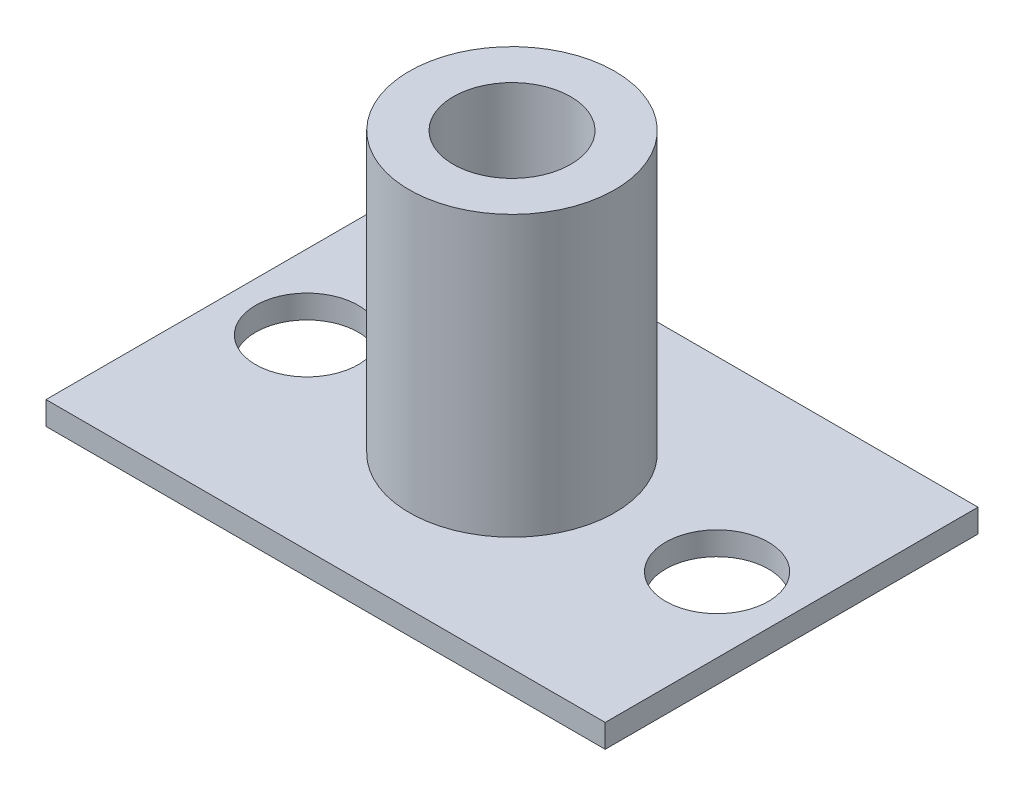
from build123d import *

# Parameters (mm, degrees)
SKETCH1_W           = 38.1
SKETCH1_H           = 25.4
BOSS_EXTRUDE1_DEPTH = 1.5875
SKETCH3_R           = 7
SKETCH3_R_2         = 4
BOSS_EXTRUDE2_DEPTH = 19.05
SKETCH4_R           = 3.5
CUT_EXTRUDE1_DEPTH  = 35.525178946


with BuildPart() as part:
    # Sketch1 → Boss-Extrude1 (new body)
    with BuildSketch(Plane(origin=(0, 0, 0), x_dir=(1, 0, 0), z_dir=(0, 1, 0))):
        with Locations((-6.79173913, 0)):
            Rectangle(SKETCH1_W, SKETCH1_H)
    extrude(amount=BOSS_EXTRUDE1_DEPTH)

    # Sketch3 → Boss-Extrude2 (add)
    with BuildSketch(Plane(origin=(0, 1.5875, 0), x_dir=(1, 0, 0), z_dir=(0, 1, 0))):
        with Locations((-6.79173913, 0)):
            Circle(SKETCH3_R)
        with Locations((-6.79173913, 0)):
            Circle(SKETCH3_R_2, mode=Mode.SUBTRACT)
    extrude(amount=BOSS_EXTRUDE2_DEPTH)

    # Sketch4 → Cut-Extrude1 (cut, through all)
    with BuildSketch(Plane(origin=(0, 1.5875, 0), x_dir=(1, 0, 0), z_dir=(0, 1, 0))):
        with Locations((7.17826087, 0)):
            Circle(SKETCH4_R)
        with Locations((-20.76173913, 0)):
            Circle(SKETCH4_R)
    extrude(amount=-CUT_EXTRUDE1_DEPTH, mode=Mode.SUBTRACT)


solid = part.part
